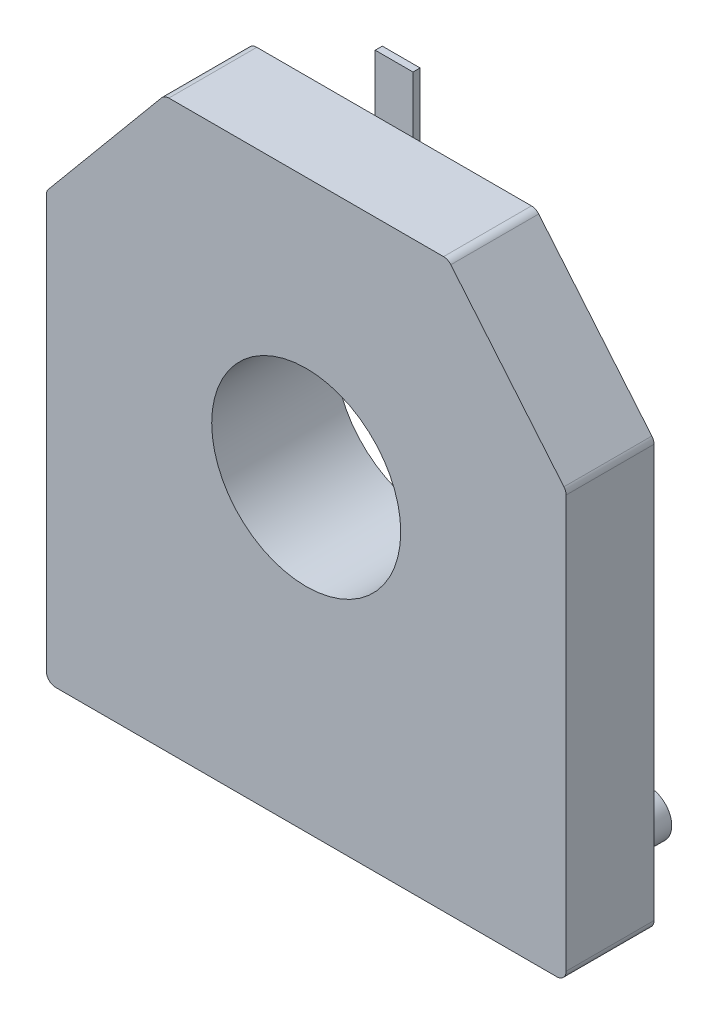
from build123d import *

# Parameters (mm, degrees)
SALIENTE_EXTRUIR1_DEPTH   = 1.86
CROQUIS2_R                = 0.475
SALIENTE_EXTRUIR2_DEPTH   = 1.15
SALIENTE_EXTRUIR3_START   = 0.75
SALIENTE_EXTRUIR3_DEPTH   = 0.75
CROQUIS4_W                = 0.4
CROQUIS4_H                = 1.624344129
SALIENTE_EXTRUIR4_DEPTH   = 0.15
CROQUIS4_W_2              = 0.8
CROQUIS4_H_2              = 3.051904831
SALIENTE_EXTRUIR4_2_DEPTH = 0.15
SALIENTE_EXTRUIR4_3_DEPTH = 0.15
REDONDEO1_R               = 0.2
SIMETR_A1_DEPTH           = 1.86
SIMETR_A1_START           = -0.75
SIMETR_A1_2_OUTLINE_R     = 0.475
SIMETR_A1_2_DEPTH         = 0.75
SIMETR_A1_START_2         = -1.15
SIMETR_A1_3_OUTLINE_R     = 0.475
SIMETR_A1_3_DEPTH         = 0.4


# Read off the part's stored shape, not the designer's step: Simetría1
with BuildPart() as part:
    # Croquis1 → Saliente-Extruir1 (new body)
    with BuildSketch(Plane.XY):
        with BuildLine():
            Line((5.5, -6.5), (5.5, 2.5))
            Line((5.5, 2.5), (3, 5.5))
            Line((3, 5.5), (0, 5.5))
            Line((0, 5.5), (0, 2))
            ThreePointArc((0, 2), (2, 0), (0, -2))
            Line((0, -2), (0, -6.5))
            Line((0, -6.5), (5.5, -6.5))
        make_face()
    extrude(amount=SALIENTE_EXTRUIR1_DEPTH)

    # Croquis2 → Saliente-Extruir2 (add)
    with BuildSketch(Plane(origin=(0, 0, 0), x_dir=(-1, 0, 0), z_dir=(0, 0, -1))):
        with Locations((-4.25, -5.525)):
            Circle(CROQUIS2_R)
    extrude(amount=SALIENTE_EXTRUIR2_DEPTH)

    # Croquis3 → Saliente-Extruir3 (add)
    with BuildSketch(Plane(origin=(0, 0, 0), x_dir=(-1, 0, 0), z_dir=(0, 0, -1)).offset(SALIENTE_EXTRUIR3_START)):
        with BuildLine():
            Line((0, 2.5), (0, 2))
            ThreePointArc((0, 2), (-2, 0), (0, -2))
            Line((0, -2), (0, -2.5))
            ThreePointArc((0, -2.5), (-2.5, 0), (0, 2.5))
        make_face()
    extrude(amount=-SALIENTE_EXTRUIR3_DEPTH)

    # Redondeo1
    redondeo1_edges = [part.edges().sort_by_distance(p)[0] for p in [
        (3, 5.5, 0.93),
        (5.5, 2.5, 0.93),
        (5.5, -6.5, 0.93),
    ]]
    fillet(redondeo1_edges, radius=REDONDEO1_R)

    # Simetría1 outline → Simetría1 (add)
    with BuildSketch(Plane.XY):
        with BuildLine():
            ThreePointArc((0, -2), (-2, 0), (0, 2))
            Line((0, 2), (0, 5.5))
            Line((0, 5.5), (-2.906325011, 5.5))
            ThreePointArc((-2.906325011, 5.5), (-2.99115609, 5.481117884), (-3.059969267, 5.42803688))
            Line((-3.059969267, 5.42803688), (-5.453644256, 2.555626893))
            ThreePointArc((-5.453644256, 2.555626893), (-5.488054316, 2.495675066), (-5.5, 2.427590013))
            Line((-5.5, 2.427590013), (-5.5, -6.3))
            ThreePointArc((-5.5, -6.3), (-5.441421356, -6.441421356), (-5.3, -6.5))
            Line((-5.3, -6.5), (0, -6.5))
            Line((0, -6.5), (0, -2))
        make_face()
    extrude(amount=SIMETR_A1_DEPTH)

    # Simetr_a1 2 outline → Simetr_a1 2 (add)
    with BuildSketch(Plane.XY.offset(SIMETR_A1_START)):
        with BuildLine():
            ThreePointArc((0, -2), (-2, 0), (0, 2))
            Line((0, 2), (0, 2.5))
            ThreePointArc((0, 2.5), (-2.5, 0), (0, -2.5))
            Line((0, -2.5), (0, -2))
        make_face()
        with Locations((-4.25, -5.525)):
            Circle(SIMETR_A1_2_OUTLINE_R)
    extrude(amount=SIMETR_A1_2_DEPTH)

    # Simetr_a1 3 outline → Simetr_a1 3 (add)
    with BuildSketch(Plane.XY.offset(SIMETR_A1_START_2)):
        with Locations((-4.25, -5.525)):
            Circle(SIMETR_A1_3_OUTLINE_R)
    extrude(amount=SIMETR_A1_3_DEPTH)


with BuildPart() as body_2:
    # Croquis4 → Saliente-Extruir4 (new body)
    with BuildSketch(Plane(origin=(0, 0, 0), x_dir=(-1, 0, 0), z_dir=(0, 0, -1))):
        with Locations((-0.2, 5.887827936)):
            Rectangle(CROQUIS4_W, CROQUIS4_H)
    saliente_extruir4 = extrude(amount=SALIENTE_EXTRUIR4_DEPTH)


with BuildPart() as body_3:
    # Croquis4 → Saliente-Extruir4 2 (new body)
    with BuildSketch(Plane(origin=(0, 0, 0), x_dir=(-1, 0, 0), z_dir=(0, 0, -1))):
        with Locations((-2.54, -6.574047585)):
            Rectangle(CROQUIS4_W_2, CROQUIS4_H_2)
    saliente_extruir4_2 = extrude(amount=SALIENTE_EXTRUIR4_2_DEPTH)


with BuildPart() as body_4:
    # Croquis4 → Saliente-Extruir4 3 (new body)
    with BuildSketch(Plane(origin=(0, 0, 0), x_dir=(-1, 0, 0), z_dir=(0, 0, -1))):
        with Locations((-0.2, -6.574047585)):
            Rectangle(CROQUIS4_W, CROQUIS4_H_2)
    saliente_extruir4_3 = extrude(amount=SALIENTE_EXTRUIR4_3_DEPTH)


with BuildPart() as part_1:
    add(part.part)

    add(body_2.part)  # Simetría2 merges body 2

    add(body_4.part)  # Simetría2 merges body 4
    # Simetría2: Saliente-Extruir4, Saliente-Extruir4 2, Saliente-Extruir4 3 across plane
    add(saliente_extruir4.mirror(Plane(origin=(0, 0, 0), x_dir=(0, 0, 1), z_dir=(1, 0, 0))))
    add(saliente_extruir4_2.mirror(Plane(origin=(0, 0, 0), x_dir=(0, 0, 1), z_dir=(1, 0, 0))))
    add(saliente_extruir4_3.mirror(Plane(origin=(0, 0, 0), x_dir=(0, 0, 1), z_dir=(1, 0, 0))))


solid = Compound([body_3.part, part_1.part])
